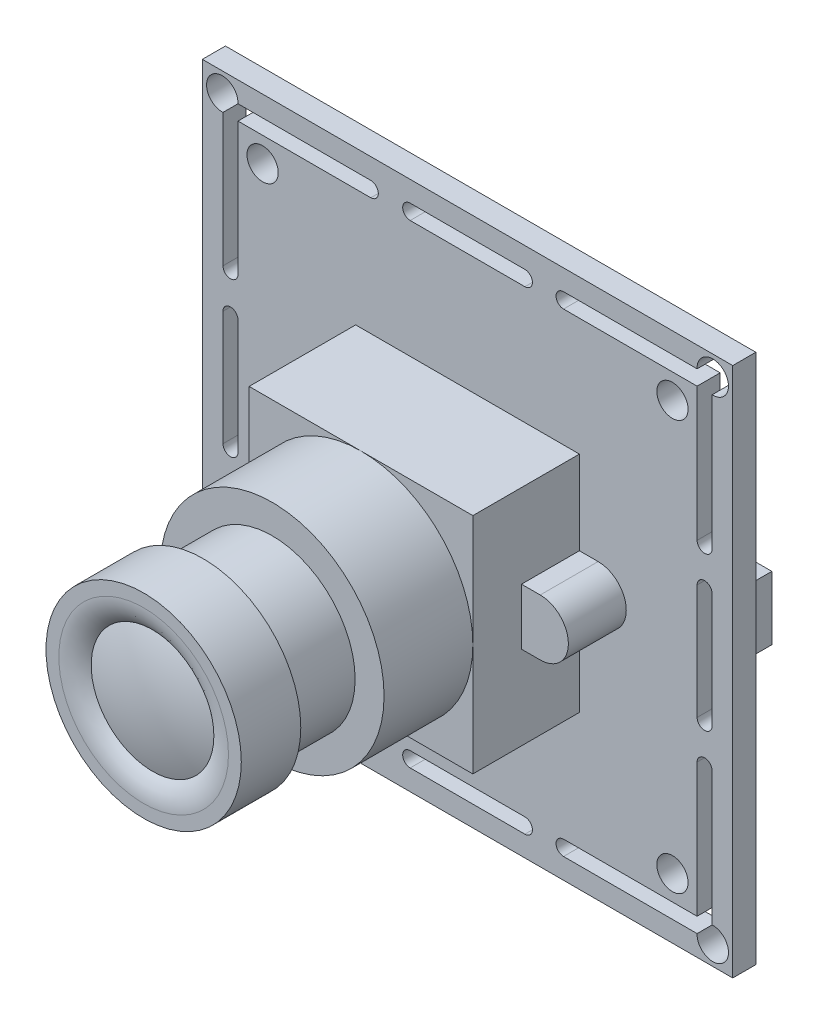
from build123d import *

# Parameters (mm, degrees)
SKETCH1_W            = 37.9349
SKETCH1_H            = 37.9349
BOSS_EXTRUDE1_DEPTH  = 1.651
SKETCH2_W            = 16.002
SKETCH2_H            = 16.002
BOSS_EXTRUDE2_DEPTH  = 7.62
SKETCH3_R            = 8.001
BOSS_EXTRUDE3_DEPTH  = 6.35
SKETCH4_R            = 5.9309
BOSS_EXTRUDE4_DEPTH  = 4.9403
SKETCH5_R            = 6.985
BOSS_EXTRUDE5_DEPTH  = 4.2545
SKETCH6_R            = 4.38785
CUT_EXTRUDE1_DEPTH   = 0.635
FILLET2_R            = 2.54
SKETCH9_R            = 1.1176
CUT_EXTRUDE2_DEPTH   = 1.651
SKETCH12_W           = 3.3274
SKETCH12_H           = 4.5466
BOSS_EXTRUDE6_DEPTH  = 3.6957
SKETCH13_W           = 10.16
SKETCH13_H           = 4.7117
BOSS_EXTRUDE7_DEPTH  = 5.6515
SKETCH14_W           = 4.8006
SKETCH14_H           = 6.0833
BOSS_EXTRUDE8_DEPTH  = 5.842
SKETCH15_W           = 3.3528
SKETCH15_H           = 4.5212
BOSS_EXTRUDE9_DEPTH  = 4.6101
BOSS_EXTRUDE10_DEPTH = 4.1402


# Read off the part's stored shape, not the designer's step: Dome1
with BuildPart() as part:
    # Sketch1 → Boss-Extrude1 (new body)
    with BuildSketch(Plane.XY):
        with Locations((18.96745, 18.96745)):
            Rectangle(SKETCH1_W, SKETCH1_H)
    extrude(amount=BOSS_EXTRUDE1_DEPTH)

    # Sketch2 → Boss-Extrude2 (add)
    with BuildSketch(Plane.XY.offset(1.651)):
        with Locations((18.96745, 18.96745)):
            Rectangle(SKETCH2_W, SKETCH2_H)
    extrude(amount=BOSS_EXTRUDE2_DEPTH)

    # Sketch3 → Boss-Extrude3 (add)
    with BuildSketch(Plane.XY.offset(9.271)):
        with Locations((18.96745, 18.96745)):
            Circle(SKETCH3_R)
    extrude(amount=BOSS_EXTRUDE3_DEPTH)

    # Sketch4 → Boss-Extrude4 (add)
    with BuildSketch(Plane.XY.offset(15.621)):
        with Locations((18.96745, 18.96745)):
            Circle(SKETCH4_R)
    extrude(amount=BOSS_EXTRUDE4_DEPTH)

    # Sketch5 → Boss-Extrude5 (add)
    with BuildSketch(Plane.XY.offset(20.5613)):
        with Locations((18.96745, 18.96745)):
            Circle(SKETCH5_R)
    extrude(amount=BOSS_EXTRUDE5_DEPTH)

    # Sketch6 → Cut-Extrude1 (cut)
    with BuildSketch(Plane.XY.offset(24.8158)):
        with Locations((18.96745, 18.96745)):
            Circle(SKETCH6_R)
    extrude(amount=-CUT_EXTRUDE1_DEPTH, mode=Mode.SUBTRACT)

    # Fillet2
    # the kernel refuses this fillet: 2.54 mm, written as the material it takes off along each edge
    with BuildSketch(Plane(origin=(18.96745, 18.96745, 24.8158), x_dir=(1, 0, 0), z_dir=(0, -1, 0))) as fillet2_piece_1:
        with BuildLine():
            CenterArc((6.067902083, -2.54), FILLET2_R, 90, 41.409622109)
            Line((4.38785, -0.635), (4.354248958, -0.5969))
            ThreePointArc((4.354248958, -0.5969), (4.33705, -0.3175), (4.33705, 0))
            Line((4.33705, 0), (4.38785, 0.0508))
            Line((4.38785, 0.0508), (6.067902083, 0.0508))
            Line((6.067902083, 0.0508), (6.067902083, 0))
        make_face()
    revolve(axis=Axis((18.96745, 18.96745, 24.8158), (0, 0, 1)), mode=Mode.SUBTRACT)

    # Dome1 outline → Dome1 (revolve)
    with BuildSketch(Plane(origin=(18.96745, 18.96745, 0), x_dir=(1, 0, 0), z_dir=(0, -1, 0))):
        with BuildLine():
            Line((0, 24.1808), (4.387850012, 24.180799996))
            ThreePointArc((4.387850012, 24.180799996), (2.22676176, 24.75088497), (0, 24.9428))
            Line((0, 24.9428), (0, 24.1808))
        make_face()
    revolve(axis=Axis((18.96745, 18.96745, 0), (0, 0, 1)))

    # Sketch9 → Cut-Extrude2 (cut)
    with BuildSketch(Plane.XY.offset(1.651)):
        with Locations((33.62325, 33.62325)):
            Circle(SKETCH9_R)
        with Locations((4.31165, 33.62325)):
            Circle(SKETCH9_R)
        with Locations((4.31165, 4.31165)):
            Circle(SKETCH9_R)
        with Locations((33.62325, 4.31165)):
            Circle(SKETCH9_R)
        with BuildLine():
            Line((35.385619933, 12.100169933), (35.385619933, 2.549280067))
            Line((35.385619933, 2.549280067), (25.834730067, 2.549280067))
            ThreePointArc((25.834730067, 2.549280067), (25.2984, 2.01295), (25.834730067, 1.476619933))
            Line((25.834730067, 1.476619933), (35.385619933, 1.476619933))
            ThreePointArc((35.385619933, 1.476619933), (37.303202335, 0.631697665), (36.458280067, 2.549280067))
            Line((36.458280067, 2.549280067), (36.458280067, 12.100169933))
            ThreePointArc((36.458280067, 12.100169933), (35.92195, 12.6365), (35.385619933, 12.100169933))
        make_face()
        with BuildLine():
            Line((35.385619933, 36.458280067), (25.834730067, 36.458280067))
            ThreePointArc((25.834730067, 36.458280067), (25.2984, 35.92195), (25.834730067, 35.385619933))
            Line((25.834730067, 35.385619933), (35.385619933, 35.385619933))
            Line((35.385619933, 35.385619933), (35.385619933, 25.834730067))
            ThreePointArc((35.385619933, 25.834730067), (35.92195, 25.2984), (36.458280067, 25.834730067))
            Line((36.458280067, 25.834730067), (36.458280067, 35.385619933))
            ThreePointArc((36.458280067, 35.385619933), (37.303202335, 37.303202335), (35.385619933, 36.458280067))
        make_face()
        with BuildLine():
            Line((12.048880067, 36.458280067), (2.549280067, 36.458280067))
            ThreePointArc((2.549280067, 36.458280067), (0.631697665, 37.303202335), (1.476619933, 35.385619933))
            Line((1.476619933, 35.385619933), (1.476619933, 25.886019933))
            ThreePointArc((1.476619933, 25.886019933), (2.01295, 25.349689867), (2.549280067, 25.886019933))
            Line((2.549280067, 25.886019933), (2.549280067, 35.385619933))
            Line((2.549280067, 35.385619933), (12.048880067, 35.385619933))
            ThreePointArc((12.048880067, 35.385619933), (12.585210133, 35.92195), (12.048880067, 36.458280067))
        make_face()
        with BuildLine():
            Line((23.06955, 36.458280067), (14.86535, 36.458280067))
            ThreePointArc((14.86535, 36.458280067), (14.329019933, 35.92195), (14.86535, 35.385619933))
            Line((14.86535, 35.385619933), (23.06955, 35.385619933))
            ThreePointArc((23.06955, 35.385619933), (23.605880067, 35.92195), (23.06955, 36.458280067))
        make_face()
        with BuildLine():
            Line((2.549280067, 23.06955), (2.549280067, 14.86535))
            ThreePointArc((2.549280067, 14.86535), (2.01295, 14.329019933), (1.476619933, 14.86535))
            Line((1.476619933, 14.86535), (1.476619933, 23.06955))
            ThreePointArc((1.476619933, 23.06955), (2.01295, 23.605880067), (2.549280067, 23.06955))
        make_face()
        with BuildLine():
            Line((36.458280067, 23.06955), (36.458280067, 14.86535))
            ThreePointArc((36.458280067, 14.86535), (35.92195, 14.329019933), (35.385619933, 14.86535))
            Line((35.385619933, 14.86535), (35.385619933, 23.06955))
            ThreePointArc((35.385619933, 23.06955), (35.92195, 23.605880067), (36.458280067, 23.06955))
        make_face()
        with BuildLine():
            Line((23.06955, 2.549280067), (14.86535, 2.549280067))
            ThreePointArc((14.86535, 2.549280067), (14.329019933, 2.01295), (14.86535, 1.476619933))
            Line((14.86535, 1.476619933), (23.06955, 1.476619933))
            ThreePointArc((23.06955, 1.476619933), (23.605880067, 2.01295), (23.06955, 2.549280067))
        make_face()
        with BuildLine():
            Line((2.549280067, 12.100169933), (2.549280067, 2.549280067))
            Line((2.549280067, 2.549280067), (12.100169933, 2.549280067))
            ThreePointArc((12.100169933, 2.549280067), (12.6365, 2.01295), (12.100169933, 1.476619933))
            Line((12.100169933, 1.476619933), (2.600569933, 1.476619933))
            ThreePointArc((2.600569933, 1.476619933), (0.681867267, 0.681867267), (1.476619933, 2.600569933))
            Line((1.476619933, 2.600569933), (1.476619933, 12.100169933))
            ThreePointArc((1.476619933, 12.100169933), (2.01295, 12.6365), (2.549280067, 12.100169933))
        make_face()
    extrude(amount=-CUT_EXTRUDE2_DEPTH, mode=Mode.SUBTRACT)

    # Sketch12 → Boss-Extrude6 (add)
    with BuildSketch(Plane(origin=(0, 0, 0), x_dir=(-1, 0, 0), z_dir=(0, 0, -1))):
        with Locations((-33.721919933, 18.96745)):
            Rectangle(SKETCH12_W, SKETCH12_H)
    extrude(amount=BOSS_EXTRUDE6_DEPTH)

    # Sketch13 → Boss-Extrude7 (add)
    with BuildSketch(Plane(origin=(0, 0, 0), x_dir=(-1, 0, 0), z_dir=(0, 0, -1))):
        with Locations((-23.8125, 4.905130067)):
            Rectangle(SKETCH13_W, SKETCH13_H)
    extrude(amount=BOSS_EXTRUDE7_DEPTH)

    # Sketch14 → Boss-Extrude8 (add)
    with BuildSketch(Plane(origin=(0, 0, 0), x_dir=(-1, 0, 0), z_dir=(0, 0, -1))):
        with Locations((-4.949580067, 12.02055)):
            Rectangle(SKETCH14_W, SKETCH14_H)
    extrude(amount=BOSS_EXTRUDE8_DEPTH)

    # Sketch15 → Boss-Extrude9 (add)
    with BuildSketch(Plane(origin=(0, 0, 0), x_dir=(-1, 0, 0), z_dir=(0, 0, -1))):
        with Locations((-4.225680067, 17.3228)):
            Rectangle(SKETCH15_W, SKETCH15_H)
    extrude(amount=BOSS_EXTRUDE9_DEPTH)

    # Sketch16 → Boss-Extrude10 (add)
    with BuildSketch(Plane.XY.offset(1.651)):
        with BuildLine():
            Line((26.96845, 16.9545), (28.30703, 16.9545))
            ThreePointArc((28.30703, 16.9545), (30.31998, 18.96745), (28.30703, 20.9804))
            Line((28.30703, 20.9804), (26.96845, 20.9804))
            Line((26.96845, 20.9804), (26.96845, 16.9545))
        make_face()
        with BuildLine():
            Line((9.62787, 20.9804), (10.96645, 20.9804))
            Line((10.96645, 20.9804), (10.96645, 16.9545))
            Line((10.96645, 16.9545), (9.62787, 16.9545))
            ThreePointArc((9.62787, 16.9545), (7.61492, 18.96745), (9.62787, 20.9804))
        make_face()
    extrude(amount=BOSS_EXTRUDE10_DEPTH)


solid = part.part
